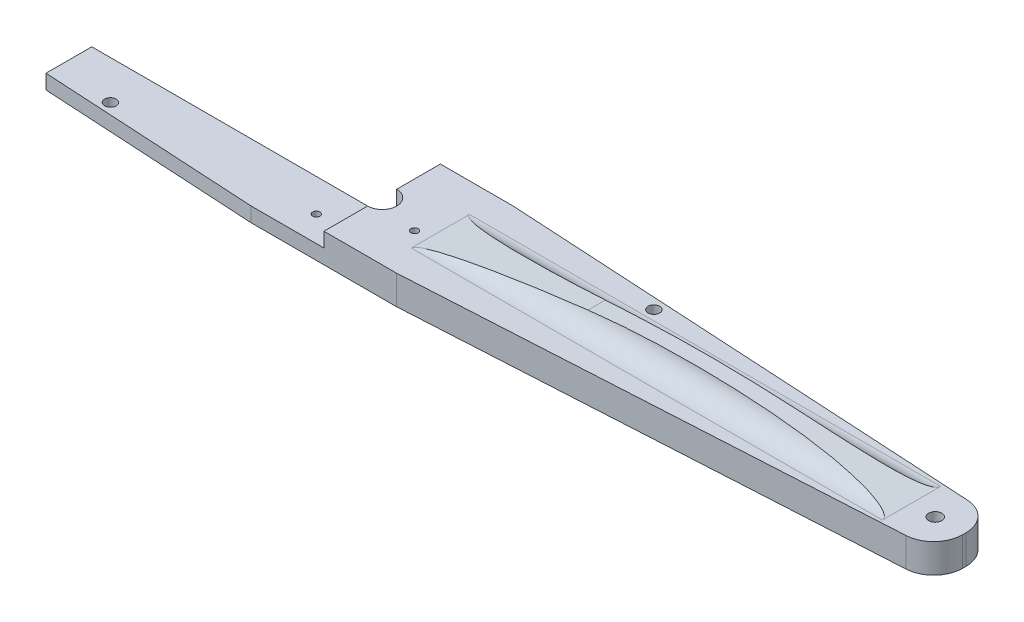
from build123d import *
from build123d.topology import SkipClean

# Parameters (mm, degrees)
BOSS_EXTRUDE1_DEPTH  = 20
SKETCH3_R            = 1.25
SKETCH3_R_2          = 5
SKETCH3_R_3          = 2.25
CUT_EXTRUDE1_DEPTH   = 40
CUT_EXTRUDE2_DEPTH   = 40
MIRROR2_COPY_1_DEPTH = 40
BOSS_EXTRUDE3_DEPTH  = 2.5
SKETCH6_W            = 103.671116399
SKETCH6_H            = 23.957467505
CUT_EXTRUDE3_DEPTH   = 25
SKETCH7_W            = 105.212539013
SKETCH7_H            = 19.765490072
CUT_EXTRUDE4_DEPTH   = 25
SKETCH8_W            = 102.846794358
SKETCH8_H            = 18.402184695
CUT_EXTRUDE5_DEPTH   = 50
SKETCH9_W            = 100
SKETCH9_H            = 9.37939479
CUT_EXTRUDE6_DEPTH   = 50
FILLET2_R            = 10
FILLET3_R            = 400
FILLET4_START        = -2.563828285
FILLET4_DEPTH        = 5.127667015
FILLET4_START_2      = -10.0000001
FILLET4_2_DEPTH      = 20.0000001
FILLET4_START_3      = 19.9999999
FILLET4_3_DEPTH      = 163.0000001
SKETCH10_R           = 2
CUT_EXTRUDE7_DEPTH   = 10


with BuildPart() as part:
    # Sketch2 → Boss-Extrude1 (new, symmetric)
    with BuildSketch(Plane.XY):
        Polygon((0, 0), (200, 0), (200, 10), (-200, 10), (-200, 0), align=None)
    extrude(amount=BOSS_EXTRUDE1_DEPTH, both=True)

    # Sketch3 → Cut-Extrude1 (cut)
    with BuildSketch(Plane(origin=(0, 10, 0), x_dir=(1, 0, 0), z_dir=(0, 1, 0))):
        with Locations(Location((-4, 15.491933385, 0), (0, 0, 180))):
            Circle(SKETCH3_R)
        with Locations(Location((15.416407865, -4.281865077, 0), (0, 0, 180))):
            Circle(SKETCH3_R)
        with Locations(Location((-11.416407865, -11.210068308, 0), (0, 0, 180))):
            Circle(SKETCH3_R)
        with Locations(Location((0, 0, 0), (0, 0, 180))):
            Circle(SKETCH3_R_2)
        with Locations(Location((-190, 0, 0), (0, 0, 180))):
            Circle(SKETCH3_R_3)
        with Locations(Location((190, 0, 0), (0, 0, 270))):
            Circle(SKETCH3_R_3)
    extrude(amount=-CUT_EXTRUDE1_DEPTH, mode=Mode.SUBTRACT)

    # Sketch4 → Cut-Extrude2 (cut)
    with BuildSketch(Plane(origin=(0, 10, 0), x_dir=(1, 0, 0), z_dir=(0, 1, 0))):
        Polygon((-205.682411406, 30.266574236), (-25, 30.266574236), (-25, 20), (-200, 10), (-205.682411406, 10), align=None)
    cut_extrude2 = extrude(amount=-CUT_EXTRUDE2_DEPTH, mode=Mode.SUBTRACT)

    # Mirror1: Cut-Extrude2 across plane
    add(cut_extrude2.mirror(Plane(origin=(0, 0, 0), x_dir=(0, 0, 1), z_dir=(1, 0, 0))), mode=Mode.SUBTRACT)

    # Mirror2: Cut-Extrude2 across plane
    add(cut_extrude2.mirror(Plane.XY), mode=Mode.SUBTRACT)

    # Mirror2 copy 1 sketch → Mirror2 copy 1 (cut)
    with BuildSketch(Plane(origin=(0, 10, 0), x_dir=(-1, 0, 0), z_dir=(0, 1, 0))):
        Polygon((-205.682411406, 30.266574236), (-25, 30.266574236), (-25, 20), (-200, 10), (-205.682411406, 10), align=None)
    extrude(amount=-MIRROR2_COPY_1_DEPTH, mode=Mode.SUBTRACT)

    # Sketch5 → Boss-Extrude3 (add, symmetric)
    with BuildSketch(Plane.XY):
        Polygon((-181.848966048, 10), (-20, 10), (-130, 20), align=None)
    boss_extrude3 = extrude(amount=BOSS_EXTRUDE3_DEPTH, both=True)

    # Mirror3: Boss-Extrude3 across plane
    add(boss_extrude3.mirror(Plane(origin=(0, 0, 0), x_dir=(0, 0, 1), z_dir=(1, 0, 0))))

    # Sketch6 → Cut-Extrude3 (cut, symmetric)
    with BuildSketch(Plane.XY):
        with Locations((-151.594267329, 11.978733753)):
            Rectangle(SKETCH6_W, SKETCH6_H)
    extrude(amount=CUT_EXTRUDE3_DEPTH, both=True, mode=Mode.SUBTRACT)

    # Sketch7 → Cut-Extrude4 (cut, symmetric)
    with BuildSketch(Plane.XY):
        with Locations((-52.606269507, 14.882745036)):
            Rectangle(SKETCH7_W, SKETCH7_H)
    extrude(amount=CUT_EXTRUDE4_DEPTH, both=True, mode=Mode.SUBTRACT)

    # Sketch8 → Cut-Extrude5 (cut)
    with BuildSketch(Plane.XY):
        with Locations((-51.423397179, -0.639817385)):
            Rectangle(SKETCH8_W, SKETCH8_H)
    extrude(amount=-CUT_EXTRUDE5_DEPTH, mode=Mode.SUBTRACT)

    # Sketch9 → Cut-Extrude6 (cut)
    with BuildSketch(Plane.XY):
        with Locations((50, 0.310302605)):
            Rectangle(SKETCH9_W, SKETCH9_H)
    extrude(amount=-CUT_EXTRUDE6_DEPTH, mode=Mode.SUBTRACT)

    # Fillet2
    fillet2_edges = [part.edges().sort_by_distance(p)[0] for p in [
        (200, 5, -10),
        (200, 5, 10),
    ]]
    fillet(fillet2_edges, radius=FILLET2_R)

    # Fillet3
    # the kernel refuses this fillet: 400 mm, written as the material it takes off along each edge
    with BuildSketch(Plane(origin=(130, 20, 143.859110373), x_dir=(0.9819042977432754, -0.1893777972025378, 0), z_dir=(0, 0, -1))) as fillet3_piece_1:
        with BuildLine():
            CenterArc((56.676030542, 399.981263631), FILLET3_R, 253.889095702, 15.55633982)
            Line((-54.322969389, 15.690719883), (-56.542949388, 8.004909008))
            Line((-56.542949388, 8.004909008), (-2.219979999, -7.685810875))
            Line((-2.219979999, -7.685810875), (0, -8))
            ThreePointArc((0, -8), (26.402250284, -8), (52.727069969, -7.999625273))
            Line((52.727069969, -7.999625273), (52.804500568, 0))
        make_face()
    extrude(amount=287.718220747, mode=Mode.SUBTRACT)

    # Fillet4: read off the stored shape, not the designer's step
    # Fillet4 outline → Fillet4 (add)
    with SkipClean():  # the faces are left unmerged after this step: merging them gives an invalid solid
        with BuildSketch(Plane.XY.offset(FILLET4_START)):
            with BuildLine():
                ThreePointArc((181.84896605, 10), (127.934669494, 16.116857351), (73.688568923, 14.880778993))
                Line((73.688568923, 14.880778993), (20, 10))
                Line((20, 10), (181.84896605, 10))
            make_face()
        extrude(amount=FILLET4_DEPTH)

    # Fillet4 2 outline → Fillet4 2 (add)
    with BuildSketch(Plane.XY.offset(FILLET4_START_2)):
        with BuildLine():
            ThreePointArc((181.84896605, 10), (127.934669494, 16.116857351), (73.688568923, 14.880778993))
            Line((73.688568923, 14.880778993), (20, 10))
            Line((20, 10), (181.84896605, 10))
        make_face()
    extrude(amount=FILLET4_2_DEPTH)

    # Fillet4 3 outline → Fillet4 3 (cut)
    with BuildSketch(Plane.YZ.offset(FILLET4_START_3)):
        with BuildLine():
            ThreePointArc((16.523566776, -2.5638331), (11.862037195, -5.053953558), (10, -10))
            Line((10, -10), (18, -10.0000001))
            Line((18, -10.0000001), (18, -2.369964609))
            Line((18, -2.369964609), (16.523566776, -2.5638331))
        make_face()
        with BuildLine():
            Line((16.523565368, 2.563833285), (18, 2.369964325))
            Line((18, 2.369964325), (18, 10))
            Line((18, 10), (10, 10))
            ThreePointArc((10, 10), (11.862036727, 5.053954091), (16.523565368, 2.563833285))
        make_face()
    extrude(amount=FILLET4_3_DEPTH, mode=Mode.SUBTRACT)

    # Sketch10 → Cut-Extrude7 (cut)
    with BuildSketch(Plane(origin=(0, 10, 0), x_dir=(1, 0, 0), z_dir=(0, 1, 0))):
        with Locations(Location((80, 13.351433229, 0), (0, 0, 180))):
            Circle(SKETCH10_R)
        with Locations(Location((-80, -13.351433229, 0), (0, 0, 180))):
            Circle(SKETCH10_R)
    extrude(amount=-CUT_EXTRUDE7_DEPTH, mode=Mode.SUBTRACT)


solid = part.part
